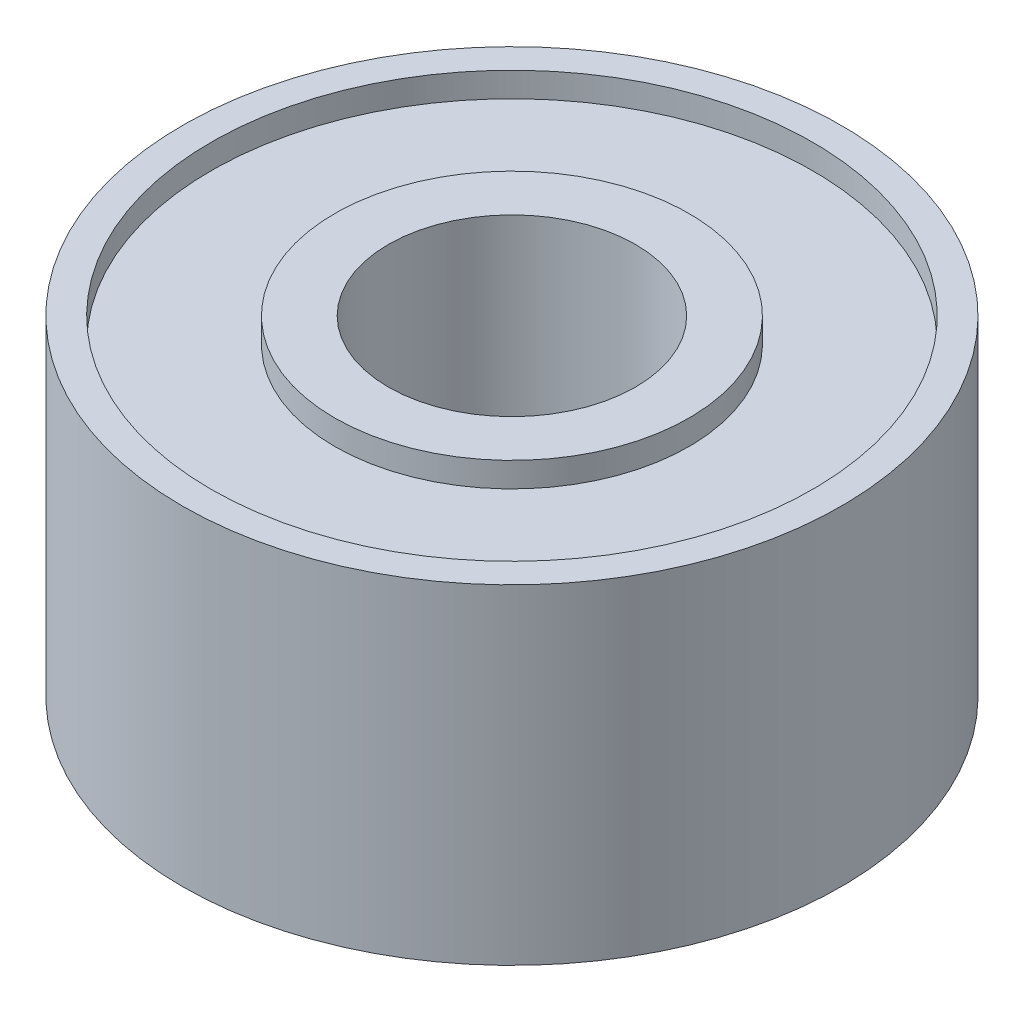
from build123d import *

# Parameters (mm, degrees)
SKETCH1_R              = 4
SKETCH1_R_2            = 1.5
BASE_SIZE_DEPTH        = 4
SKETCH2_R              = 3.65
SKETCH2_R_2            = 2.15
BEARING_FEATURES_DEPTH = 0.3


with BuildPart() as part:
    # Sketch1 → Base size (new body)
    with BuildSketch(Plane(origin=(0, 0, 0), x_dir=(1, 0, 0), z_dir=(0, 1, 0))):
        Circle(SKETCH1_R)
        Circle(SKETCH1_R_2, mode=Mode.SUBTRACT)
    extrude(amount=BASE_SIZE_DEPTH)

    # Sketch2 → Bearing features (cut)
    with BuildSketch(Plane(origin=(0, 4, 0), x_dir=(1, 0, 0), z_dir=(0, 1, 0))):
        Circle(SKETCH2_R)
        Circle(SKETCH2_R_2, mode=Mode.SUBTRACT)
    bearing_features = extrude(amount=-BEARING_FEATURES_DEPTH, mode=Mode.SUBTRACT)

    # Mirror1: Bearing features across plane
    add(bearing_features.mirror(Plane.ZX.offset(2)), mode=Mode.SUBTRACT)


solid = part.part
